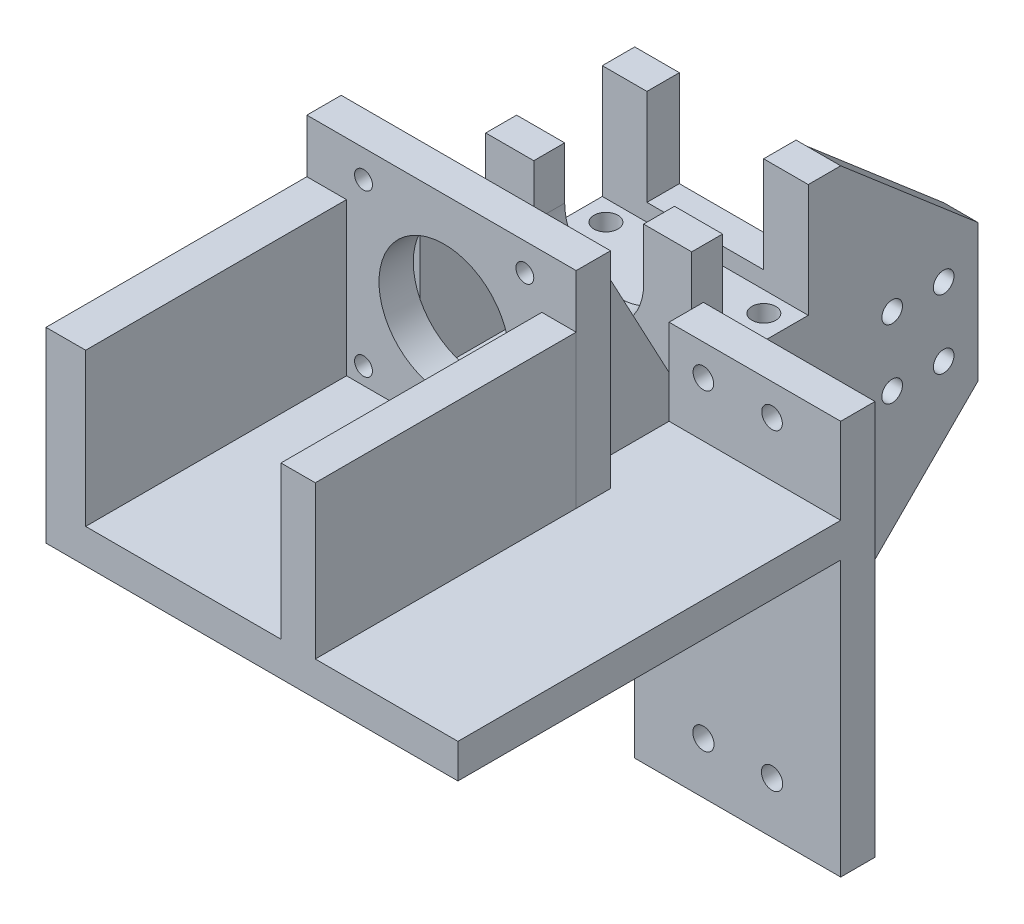
from build123d import *

# Parameters (mm, degrees)
BOSS_EXTRUDE1_DEPTH  = 10
SKETCH2_W            = 60
SKETCH2_H            = 25
BOSS_EXTRUDE2_DEPTH  = 6.45
SKETCH3_W            = 60
SKETCH3_H            = 9.45
BOSS_EXTRUDE3_DEPTH  = 39.45
SKETCH4_W            = 34
SKETCH4_H            = 28
CUT_EXTRUDE1_DEPTH   = 9.45
SKETCH5_W            = 60
SKETCH5_H            = 9
BOSS_EXTRUDE4_DEPTH  = 39.45
CUT_EXTRUDE2_REACH   = 170.798
BOSS_EXTRUDE5_DEPTH  = 80
SKETCH8_W            = 75.99709589
SKETCH8_H            = 54.458409134
BOSS_EXTRUDE6_DEPTH  = 10
SKETCH9_W            = 10
SKETCH9_H            = 75.99709589
BOSS_EXTRUDE7_DEPTH  = 44.46
SKETCH17_W           = 78.45
SKETCH17_H           = 10
BOSS_EXTRUDE27_DEPTH = 60
SKETCH19_W           = 2.5
SKETCH19_H           = 60
BOSS_EXTRUDE31_DEPTH = 32
SKETCH20_W           = 75.99709589
SKETCH20_H           = 44.458409134
BOSS_EXTRUDE32_DEPTH = 1.55
SKETCH21_R           = 2.6
SKETCH21_R_2         = 19
CUT_EXTRUDE3_DEPTH   = 10
CUT_EXTRUDE4_REACH   = 213.153
SKETCH22_R           = 3.5
CUT_EXTRUDE5_REACH   = 191.962
SKETCH23_W           = 27
SKETCH23_H           = 6
CUT_EXTRUDE6_REACH   = 191.962
SKETCH24_R           = 3.1
CUT_EXTRUDE7_REACH   = 177.882
SKETCH25_R           = 3.1
CUT_EXTRUDE10_DEPTH  = 70
SKETCH27_W           = 50
SKETCH27_H           = 10
BOSS_EXTRUDE33_DEPTH = 25
CUT_EXTRUDE11_REACH  = 177.882
SKETCH28_R           = 3
SKETCH29_W           = 10
SKETCH29_H           = 40
BOSS_EXTRUDE34_DEPTH = 40
CUT_EXTRUDE12_REACH  = 226.958
SKETCH30_R           = 3
BOSS_EXTRUDE35_DEPTH = 10


with BuildPart() as part:
    # Sketch1 → Boss-Extrude1 (new body)
    with BuildSketch(Plane(origin=(0, 0, 0), x_dir=(1, 0, 0), z_dir=(0, 1, 0))):
        Polygon((0, 0), (0, 161.51), (60, 161.51), (60, 121.51), (110, 121.51), (110, 0), align=None)
    extrude(amount=BOSS_EXTRUDE1_DEPTH)

    # Sketch2 → Boss-Extrude2 (add)
    with BuildSketch(Plane(origin=(0, 10, 0), x_dir=(1, 0, 0), z_dir=(0, 1, 0))):
        with Locations((30, 139.6)):
            Rectangle(SKETCH2_W, SKETCH2_H)
    extrude(amount=BOSS_EXTRUDE2_DEPTH)

    # Sketch3 → Boss-Extrude3 (add)
    with BuildSketch(Plane(origin=(0, 10, 0), x_dir=(1, 0, 0), z_dir=(0, 1, 0))):
        with Locations((30, 156.785)):
            Rectangle(SKETCH3_W, SKETCH3_H)
    extrude(amount=BOSS_EXTRUDE3_DEPTH)

    # Sketch4 → Cut-Extrude1 (cut)
    with BuildSketch(Plane(origin=(0, 0, -161.51), x_dir=(-1, 0, 0), z_dir=(0, 0, -1))):
        with Locations((-30, 35.45)):
            Rectangle(SKETCH4_W, SKETCH4_H)
    extrude(amount=-CUT_EXTRUDE1_DEPTH, mode=Mode.SUBTRACT)

    # Sketch5 → Boss-Extrude4 (add)
    with BuildSketch(Plane(origin=(0, 10, 0), x_dir=(1, 0, 0), z_dir=(0, 1, 0))):
        with Locations((30, 122.6)):
            Rectangle(SKETCH5_W, SKETCH5_H)
    extrude(amount=BOSS_EXTRUDE4_DEPTH)

    # Sketch6 → Cut-Extrude2 (cut, up to next)
    with BuildSketch(Plane.XY.offset(-118.1), mode=Mode.PRIVATE) as cut_extrude2_sk1:
        with BuildLine():
            Line((14, 34.24), (14, 49.45))
            Line((14, 49.45), (46, 49.45))
            Line((46, 49.45), (46, 34.24))
            ThreePointArc((46, 34.24), (30, 18.24), (14, 34.24))
        make_face()
    cut_extrude2_tool1 = extrude(cut_extrude2_sk1.sketch, amount=-CUT_EXTRUDE2_REACH, mode=Mode.PRIVATE) & part.part
    add(cut_extrude2_tool1.solids().sort_by_distance((30, 35.332249, -118.1))[0], mode=Mode.SUBTRACT)

    # Sketch7 → Boss-Extrude5 (add)
    with BuildSketch(Plane.XZ):
        Polygon((110, -111.51), (50, -111.51), (50, -161.51), (60, -161.51), (60, -121.51), (110, -121.51), align=None)
    extrude(amount=BOSS_EXTRUDE5_DEPTH)

    # Sketch8 → Boss-Extrude6 (add)
    with BuildSketch(Plane.ZY):
        with Locations((-37.998547945, 27.229204567)):
            Rectangle(SKETCH8_W, SKETCH8_H)
    extrude(amount=BOSS_EXTRUDE6_DEPTH)

    # Sketch9 → Boss-Extrude7 (add)
    with BuildSketch(Plane(origin=(0, 10, 0), x_dir=(1, 0, 0), z_dir=(0, 1, 0))):
        with Locations((63.45, 37.998547945)):
            Rectangle(SKETCH9_W, SKETCH9_H)
    extrude(amount=BOSS_EXTRUDE7_DEPTH)

    # Sketch17 → Boss-Extrude27 (add)
    with BuildSketch(Plane(origin=(0, 10, 0), x_dir=(1, 0, 0), z_dir=(0, 1, 0))):
        with Locations((29.225, 81)):
            Rectangle(SKETCH17_W, SKETCH17_H)
    extrude(amount=BOSS_EXTRUDE27_DEPTH)

    # Sketch19 → Boss-Extrude31 (add)
    with BuildSketch(Plane(origin=(0, 0, -86), x_dir=(-1, 0, 0), z_dir=(0, 0, -1))):
        with Locations((-1.25, 40)):
            Rectangle(SKETCH19_W, SKETCH19_H)
        with Locations((-11.75, 40)):
            Rectangle(SKETCH19_W, SKETCH19_H)
        with Locations((-48.25, 40)):
            Rectangle(SKETCH19_W, SKETCH19_H)
        with Locations((-58.75, 40)):
            Rectangle(SKETCH19_W, SKETCH19_H)
    extrude(amount=BOSS_EXTRUDE31_DEPTH)

    # Sketch20 → Boss-Extrude32 (add)
    with BuildSketch(Plane(origin=(0, 0, 0), x_dir=(0, 0, -1), z_dir=(1, 0, 0))):
        with Locations((37.998547945, 32.229204567)):
            Rectangle(SKETCH20_W, SKETCH20_H)
    extrude(amount=BOSS_EXTRUDE32_DEPTH)

    # Sketch21 → Cut-Extrude3 (cut)
    with BuildSketch(Plane.XY.offset(-76)):
        with Locations((6.5, 61.95)):
            Circle(SKETCH21_R)
        with Locations((53.5, 61.95)):
            Circle(SKETCH21_R)
        with Locations((53.5, 14.95)):
            Circle(SKETCH21_R)
        with Locations((6.5, 14.95)):
            Circle(SKETCH21_R)
        with Locations((30, 38.45)):
            Circle(SKETCH21_R_2)
    extrude(amount=-CUT_EXTRUDE3_DEPTH, mode=Mode.SUBTRACT)

    # Sketch22 → Cut-Extrude4 (cut, up to next)
    with BuildSketch(Plane.XZ, mode=Mode.PRIVATE) as cut_extrude4_sk1:
        with Locations((7.02, -146.1)):
            Circle(SKETCH22_R)
    cut_extrude4_tool1 = extrude(cut_extrude4_sk1.sketch, amount=-CUT_EXTRUDE4_REACH, mode=Mode.PRIVATE) & part.part
    # Sketch22 → Cut-Extrude4 (cut, up to next)
    with BuildSketch(Plane.XZ, mode=Mode.PRIVATE) as cut_extrude4_sk2:
        with Locations((7.02, -133)):
            Circle(SKETCH22_R)
    cut_extrude4_tool2 = extrude(cut_extrude4_sk2.sketch, amount=-CUT_EXTRUDE4_REACH, mode=Mode.PRIVATE) & part.part
    # Sketch22 → Cut-Extrude4 (cut, up to next)
    with BuildSketch(Plane.XZ, mode=Mode.PRIVATE) as cut_extrude4_sk3:
        with Locations((53.02, -146.1)):
            Circle(SKETCH22_R)
    cut_extrude4_tool3 = extrude(cut_extrude4_sk3.sketch, amount=-CUT_EXTRUDE4_REACH, mode=Mode.PRIVATE) & part.part
    # Sketch22 → Cut-Extrude4 (cut, up to next)
    with BuildSketch(Plane.XZ, mode=Mode.PRIVATE) as cut_extrude4_sk4:
        with Locations((53.02, -133)):
            Circle(SKETCH22_R)
    cut_extrude4_tool4 = extrude(cut_extrude4_sk4.sketch, amount=-CUT_EXTRUDE4_REACH, mode=Mode.PRIVATE) & part.part
    add(cut_extrude4_tool1.solids().sort_by_distance((7.02, 0, -146.1))[0], mode=Mode.SUBTRACT)
    add(cut_extrude4_tool2.solids().sort_by_distance((7.02, 0, -133))[0], mode=Mode.SUBTRACT)
    add(cut_extrude4_tool3.solids().sort_by_distance((53.02, 0, -146.1))[0], mode=Mode.SUBTRACT)
    add(cut_extrude4_tool4.solids().sort_by_distance((53.02, 0, -133))[0], mode=Mode.SUBTRACT)

    # Sketch23 → Cut-Extrude5 (cut, up to next)
    with BuildSketch(Plane.ZY.offset(-50), mode=Mode.PRIVATE) as cut_extrude5_sk1:
        with Locations((-139.6, -3)):
            Rectangle(SKETCH23_W, SKETCH23_H)
    cut_extrude5_tool1 = extrude(cut_extrude5_sk1.sketch, amount=-CUT_EXTRUDE5_REACH, mode=Mode.PRIVATE) & part.part
    add(cut_extrude5_tool1.solids().sort_by_distance((50, -3, -139.6))[0], mode=Mode.SUBTRACT)

    # Sketch24 → Cut-Extrude6 (cut, up to next)
    with BuildSketch(Plane.ZY.offset(-50), mode=Mode.PRIVATE) as cut_extrude6_sk1:
        with Locations((-151.51, -15)):
            Circle(SKETCH24_R)
    cut_extrude6_tool1 = extrude(cut_extrude6_sk1.sketch, amount=-CUT_EXTRUDE6_REACH, mode=Mode.PRIVATE) & part.part
    # Sketch24 → Cut-Extrude6 (cut, up to next)
    with BuildSketch(Plane.ZY.offset(-50), mode=Mode.PRIVATE) as cut_extrude6_sk2:
        with Locations((-151.51, -65)):
            Circle(SKETCH24_R)
    cut_extrude6_tool2 = extrude(cut_extrude6_sk2.sketch, amount=-CUT_EXTRUDE6_REACH, mode=Mode.PRIVATE) & part.part
    # Sketch24 → Cut-Extrude6 (cut, up to next)
    with BuildSketch(Plane.ZY.offset(-50), mode=Mode.PRIVATE) as cut_extrude6_sk3:
        with Locations((-131.51, -15)):
            Circle(SKETCH24_R)
    cut_extrude6_tool3 = extrude(cut_extrude6_sk3.sketch, amount=-CUT_EXTRUDE6_REACH, mode=Mode.PRIVATE) & part.part
    # Sketch24 → Cut-Extrude6 (cut, up to next)
    with BuildSketch(Plane.ZY.offset(-50), mode=Mode.PRIVATE) as cut_extrude6_sk4:
        with Locations((-131.51, -65)):
            Circle(SKETCH24_R)
    cut_extrude6_tool4 = extrude(cut_extrude6_sk4.sketch, amount=-CUT_EXTRUDE6_REACH, mode=Mode.PRIVATE) & part.part
    add(cut_extrude6_tool1.solids().sort_by_distance((50, -15, -151.51))[0], mode=Mode.SUBTRACT)
    add(cut_extrude6_tool2.solids().sort_by_distance((50, -65, -151.51))[0], mode=Mode.SUBTRACT)
    add(cut_extrude6_tool3.solids().sort_by_distance((50, -15, -131.51))[0], mode=Mode.SUBTRACT)
    add(cut_extrude6_tool4.solids().sort_by_distance((50, -65, -131.51))[0], mode=Mode.SUBTRACT)

    # Sketch25 → Cut-Extrude7 (cut, up to next)
    with BuildSketch(Plane.XY.offset(-111.51), mode=Mode.PRIVATE) as cut_extrude7_sk1:
        with Locations((70, -15)):
            Circle(SKETCH25_R)
    cut_extrude7_tool1 = extrude(cut_extrude7_sk1.sketch, amount=-CUT_EXTRUDE7_REACH, mode=Mode.PRIVATE) & part.part
    # Sketch25 → Cut-Extrude7 (cut, up to next)
    with BuildSketch(Plane.XY.offset(-111.51), mode=Mode.PRIVATE) as cut_extrude7_sk2:
        with Locations((90, -15)):
            Circle(SKETCH25_R)
    cut_extrude7_tool2 = extrude(cut_extrude7_sk2.sketch, amount=-CUT_EXTRUDE7_REACH, mode=Mode.PRIVATE) & part.part
    # Sketch25 → Cut-Extrude7 (cut, up to next)
    with BuildSketch(Plane.XY.offset(-111.51), mode=Mode.PRIVATE) as cut_extrude7_sk3:
        with Locations((70, -65)):
            Circle(SKETCH25_R)
    cut_extrude7_tool3 = extrude(cut_extrude7_sk3.sketch, amount=-CUT_EXTRUDE7_REACH, mode=Mode.PRIVATE) & part.part
    # Sketch25 → Cut-Extrude7 (cut, up to next)
    with BuildSketch(Plane.XY.offset(-111.51), mode=Mode.PRIVATE) as cut_extrude7_sk4:
        with Locations((90, -65)):
            Circle(SKETCH25_R)
    cut_extrude7_tool4 = extrude(cut_extrude7_sk4.sketch, amount=-CUT_EXTRUDE7_REACH, mode=Mode.PRIVATE) & part.part
    add(cut_extrude7_tool1.solids().sort_by_distance((70, -15, -111.51))[0], mode=Mode.SUBTRACT)
    add(cut_extrude7_tool2.solids().sort_by_distance((90, -15, -111.51))[0], mode=Mode.SUBTRACT)
    add(cut_extrude7_tool3.solids().sort_by_distance((70, -65, -111.51))[0], mode=Mode.SUBTRACT)
    add(cut_extrude7_tool4.solids().sort_by_distance((90, -65, -111.51))[0], mode=Mode.SUBTRACT)

    # Sketch26 → Cut-Extrude10 (cut)
    with BuildSketch(Plane.ZY):
        Polygon((-118.1, 10), (-86, 70), (-118, 70), align=None)
    extrude(amount=-CUT_EXTRUDE10_DEPTH, mode=Mode.SUBTRACT)

    # Sketch27 → Boss-Extrude33 (add)
    with BuildSketch(Plane(origin=(0, 10, 0), x_dir=(1, 0, 0), z_dir=(0, 1, 0))):
        with Locations((85, 116.51)):
            Rectangle(SKETCH27_W, SKETCH27_H)
    extrude(amount=BOSS_EXTRUDE33_DEPTH)

    # Sketch28 → Cut-Extrude11 (cut, up to next)
    with BuildSketch(Plane.XY.offset(-111.51), mode=Mode.PRIVATE) as cut_extrude11_sk1:
        with Locations((90, 25.935)):
            Circle(SKETCH28_R)
    cut_extrude11_tool1 = extrude(cut_extrude11_sk1.sketch, amount=-CUT_EXTRUDE11_REACH, mode=Mode.PRIVATE) & part.part
    # Sketch28 → Cut-Extrude11 (cut, up to next)
    with BuildSketch(Plane.XY.offset(-111.51), mode=Mode.PRIVATE) as cut_extrude11_sk2:
        with Locations((70, 25.935)):
            Circle(SKETCH28_R)
    cut_extrude11_tool2 = extrude(cut_extrude11_sk2.sketch, amount=-CUT_EXTRUDE11_REACH, mode=Mode.PRIVATE) & part.part
    add(cut_extrude11_tool1.solids().sort_by_distance((90, 25.935, -111.51))[0], mode=Mode.SUBTRACT)
    add(cut_extrude11_tool2.solids().sort_by_distance((70, 25.935, -111.51))[0], mode=Mode.SUBTRACT)

    # Sketch29 → Boss-Extrude34 (add)
    with BuildSketch(Plane(origin=(0, 0, -161.51), x_dir=(-1, 0, 0), z_dir=(0, 0, -1))):
        with Locations((-55, -4.85)):
            Rectangle(SKETCH29_W, SKETCH29_H)
    extrude(amount=BOSS_EXTRUDE34_DEPTH)

    # Sketch30 → Cut-Extrude12 (cut, up to next)
    with BuildSketch(Plane.ZY.offset(-50), mode=Mode.PRIVATE) as cut_extrude12_sk1:
        with Locations((-191.51, 5.15)):
            Circle(SKETCH30_R)
    cut_extrude12_tool1 = extrude(cut_extrude12_sk1.sketch, amount=-CUT_EXTRUDE12_REACH, mode=Mode.PRIVATE) & part.part
    # Sketch30 → Cut-Extrude12 (cut, up to next)
    with BuildSketch(Plane.ZY.offset(-50), mode=Mode.PRIVATE) as cut_extrude12_sk2:
        with Locations((-176.51, 5.15)):
            Circle(SKETCH30_R)
    cut_extrude12_tool2 = extrude(cut_extrude12_sk2.sketch, amount=-CUT_EXTRUDE12_REACH, mode=Mode.PRIVATE) & part.part
    # Sketch30 → Cut-Extrude12 (cut, up to next)
    with BuildSketch(Plane.ZY.offset(-50), mode=Mode.PRIVATE) as cut_extrude12_sk3:
        with Locations((-191.51, -14.85)):
            Circle(SKETCH30_R)
    cut_extrude12_tool3 = extrude(cut_extrude12_sk3.sketch, amount=-CUT_EXTRUDE12_REACH, mode=Mode.PRIVATE) & part.part
    # Sketch30 → Cut-Extrude12 (cut, up to next)
    with BuildSketch(Plane.ZY.offset(-50), mode=Mode.PRIVATE) as cut_extrude12_sk4:
        with Locations((-176.51, -14.85)):
            Circle(SKETCH30_R)
    cut_extrude12_tool4 = extrude(cut_extrude12_sk4.sketch, amount=-CUT_EXTRUDE12_REACH, mode=Mode.PRIVATE) & part.part
    add(cut_extrude12_tool1.solids().sort_by_distance((50, 5.15, -191.51))[0], mode=Mode.SUBTRACT)
    add(cut_extrude12_tool2.solids().sort_by_distance((50, 5.15, -176.51))[0], mode=Mode.SUBTRACT)
    add(cut_extrude12_tool3.solids().sort_by_distance((50, -14.85, -191.51))[0], mode=Mode.SUBTRACT)
    add(cut_extrude12_tool4.solids().sort_by_distance((50, -14.85, -176.51))[0], mode=Mode.SUBTRACT)

    # Sketch31 → Boss-Extrude35 (add)
    with BuildSketch(Plane.ZY.offset(-50)):
        Polygon((-161.51, 15.15), (-161.51, 49.45), (-201.51, 15.15), align=None)
        Polygon((-161.51, -24.85), (-201.51, -24.85), (-161.51, -64.85), align=None)
    extrude(amount=-BOSS_EXTRUDE35_DEPTH)


solid = part.part
